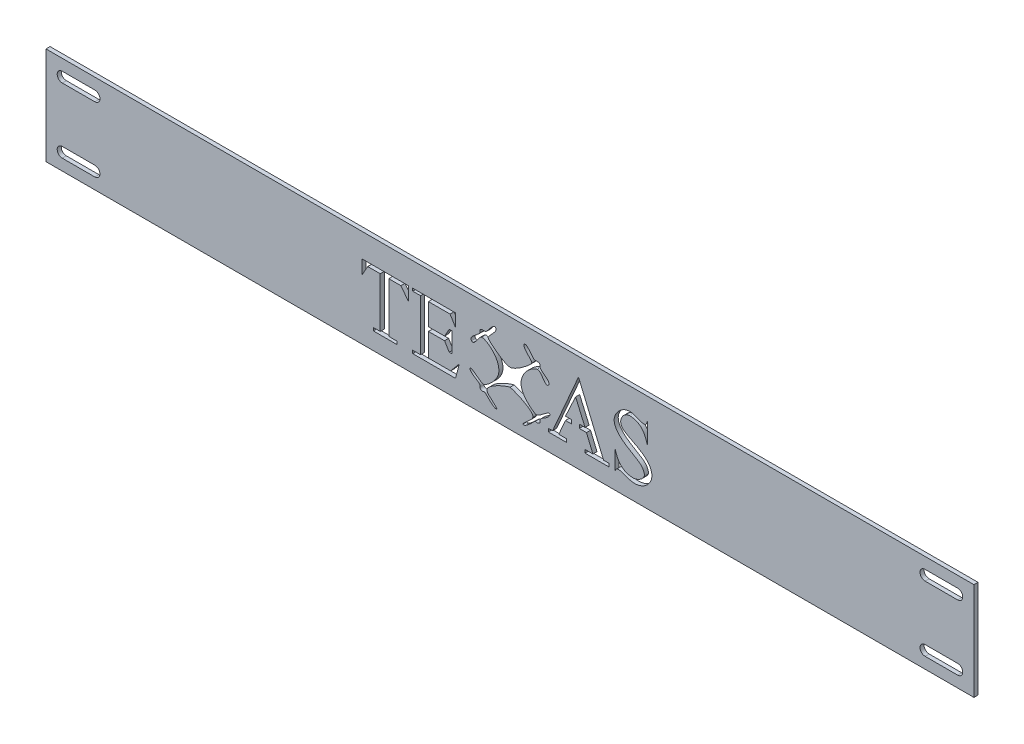
from build123d import *

# Parameters (mm, degrees)
BOSS_EXTRUDE1_DEPTH = 38.1
CUT_EXTRUDE2_DEPTH  = 364.95320119
CUT_EXTRUDE3_START  = -1.5875
CUT_EXTRUDE3_DEPTH  = 1.5875


# Read off the part's stored shape, not the designer's step: Cut-Extrude3
with BuildPart() as part:
    # Sketch1 → Boss-Extrude1 (new body)
    with BuildSketch(Plane(origin=(0, 0, 0), x_dir=(1, 0, 0), z_dir=(0, 1, 0))):
        Polygon((0, 0), (361.95, 0), (361.95, 1.5875), (336.55, 1.5875), (25.4, 1.5875), (0, 1.5875), align=None)
    extrude(amount=BOSS_EXTRUDE1_DEPTH)

    # Sketch3 → Cut-Extrude2 (cut, through all)
    with BuildSketch(Plane.XY):
        with BuildLine():
            Line((6.35, 33.734375), (19.05, 33.734375))
            ThreePointArc((19.05, 33.734375), (21.034375, 31.75), (19.05, 29.765625))
            Line((19.05, 29.765625), (6.35, 29.765625))
            ThreePointArc((6.35, 29.765625), (4.365625, 31.75), (6.35, 33.734375))
        make_face()
        with BuildLine():
            Line((6.35, 4.365625), (19.05, 4.365625))
            ThreePointArc((19.05, 4.365625), (21.034375, 6.35), (19.05, 8.334375))
            Line((19.05, 8.334375), (6.35, 8.334375))
            ThreePointArc((6.35, 8.334375), (4.365625, 6.35), (6.35, 4.365625))
        make_face()
        with BuildLine():
            Line((355.6, 4.365625), (342.9, 4.365625))
            ThreePointArc((342.9, 4.365625), (340.915625, 6.35), (342.9, 8.334375))
            Line((342.9, 8.334375), (355.6, 8.334375))
            ThreePointArc((355.6, 8.334375), (357.584375, 6.35), (355.6, 4.365625))
        make_face()
        with BuildLine():
            Line((355.6, 33.734375), (342.9, 33.734375))
            ThreePointArc((342.9, 33.734375), (340.915625, 31.75), (342.9, 29.765625))
            Line((342.9, 29.765625), (355.6, 29.765625))
            ThreePointArc((355.6, 29.765625), (357.584375, 31.75), (355.6, 33.734375))
        make_face()
    extrude(amount=-CUT_EXTRUDE2_DEPTH, mode=Mode.SUBTRACT)

    # Cut-Extrude3 outline → Cut-Extrude3 (cut)
    with BuildSketch(Plane.XY.offset(CUT_EXTRUDE3_START)):
        with BuildLine():
            add(Edge.make_bspline(
                [(195.982140594, 22.51930704), (194.799865236, 21.213982115), (193.163937726, 26.137072488), (189.808392954, 25.270049762), (185.431809743, 21.906170571), (185.113755929, 14.477855146), (190.414101335, 10.199478727), (192.394392235, 9.974909474), (195.826797456, 13.652267497), (196.575850419, 13.039862322)],
                knots=[0, 0, 0, 0, 0.189051683, 0.236249649, 0.445787434, 0.493959122, 0.669794836, 0.72259687, 1, 1, 1, 1], degree=3))
            add(Edge.make_bspline(
                [(195.982140594, 22.51930704), (197.02384643, 23.690697654), (193.434281531, 25.750289011), (192.471466966, 27.04835261), (192.942024759, 27.620203849), (192.043472718, 28.543432617), (190.501640111, 28.084350881), (189.476887898, 29.418942555), (187.135907428, 32.553032704), (185.644984613, 30.359079477), (189.672624323, 27.572101913), (189.47449607, 26.693468459)],
                knots=[0, 0, 0, 0, 0.213778603, 0.251869609, 0.366572237, 0.395020232, 0.507901568, 0.542963638, 0.710578863, 0.758377689, 1, 1, 1, 1], degree=3))
            add(Edge.make_bspline(
                [(189.47449607, 26.693468459), (189.055350229, 25.68502545), (183.278354398, 21.111711372), (180.975, 21.055893079)],
                knots=[0, 0, 0, 0, 1, 1, 1, 1], degree=3))
            add(Edge.make_bspline(
                [(172.47550393, 26.693468459), (172.894649771, 25.68502545), (178.671645602, 21.111711372), (180.975, 21.055893079)],
                knots=[0, 0, 0, 0, 1, 1, 1, 1], degree=3))
            add(Edge.make_bspline(
                [(165.967859406, 22.51930704), (164.92615357, 23.690697654), (168.515718469, 25.750289011), (169.478533034, 27.04835261), (169.007975241, 27.620203849), (169.906527282, 28.543432617), (171.448359889, 28.084350881), (172.473112102, 29.418942555), (174.814092572, 32.553032704), (176.305015387, 30.359079477), (172.277375677, 27.572101913), (172.47550393, 26.693468459)],
                knots=[0, 0, 0, 0, 0.213778603, 0.251869609, 0.366572237, 0.395020232, 0.507901568, 0.542963638, 0.710578863, 0.758377689, 1, 1, 1, 1], degree=3))
            add(Edge.make_bspline(
                [(165.967859406, 22.51930704), (167.150134764, 21.213982115), (168.786062274, 26.137072488), (172.141607046, 25.270049762), (176.518190257, 21.906170571), (176.836244071, 14.477855146), (171.535898665, 10.199478727), (169.555607765, 9.974909474), (166.123202544, 13.652267497), (165.374149581, 13.039862322)],
                knots=[0, 0, 0, 0, 0.189051683, 0.236249649, 0.445787434, 0.493959122, 0.669794836, 0.72259687, 1, 1, 1, 1], degree=3))
            add(Edge.make_bspline(
                [(165.374149581, 13.039862322), (165.125665487, 12.735624807), (166.110865819, 11.394591), (170.331042773, 9.150480258), (168.679768277, 8.544643648), (170.535734674, 7.173980297), (170.772126154, 8.136761028), (171.983030665, 6.986077763), (174.91960902, 3.896083053), (176.375069108, 4.539812082), (172.62560022, 7.186447587), (171.154498021, 10.491273862), (179.171195487, 14.056091072), (180.975, 14.279388426)],
                knots=[0, 0, 0, 0, 0.064953739, 0.094763719, 0.275506902, 0.324252674, 0.53347567, 0.577930895, 0.724349704, 0.753328343, 0.838738651, 0.864473446, 1, 1, 1, 1], degree=3))
            add(Edge.make_bspline(
                [(196.575850419, 13.039862322), (196.824334513, 12.735624807), (195.839134181, 11.394591), (191.618957227, 9.150480258), (193.270231723, 8.544643648), (191.414265326, 7.173980297), (191.177873846, 8.136761028), (189.966969335, 6.986077763), (187.03039098, 3.896083053), (185.574930892, 4.539812082), (189.32439978, 7.186447587), (190.795501979, 10.491273862), (182.778804513, 14.056091072), (180.975, 14.279388426)],
                knots=[0, 0, 0, 0, 0.064953739, 0.094763719, 0.275506902, 0.324252674, 0.53347567, 0.577930895, 0.724349704, 0.753328343, 0.838738651, 0.864473446, 1, 1, 1, 1], degree=3))
        make_face()
        with BuildLine():
            add(Edge.make_bspline(
                [(234.559937197, 21.645787396), (233.405038462, 25.773760499), (231.363748975, 27.682772658), (225.764180175, 28.326475371), (222.358816397, 22.837585378), (227.899860485, 20.605871866), (239.782021852, 13.818683951), (234.998253663, 6.441976622), (227.668644767, 5.928189123), (224.066232809, 8.264523772), (222.014289381, 7.441374025), (222.007609782, 6.32598658)],
                knots=[0, 0, 0, 0, 0.099418507, 0.119055882, 0.196373746, 0.311779581, 0.364307852, 0.681951059, 0.739922882, 0.886054264, 0.999151476, 0.999151476, 0.999151476, 0.999151476], degree=3))
            Line((234.559937197, 21.645787396), (234.559937197, 29.5793327))
            add(Edge.make_bspline(
                [(222.00760979, 13.905297607), (223.191069921, 9.673284198), (225.738636972, 7.861739614), (230.39632568, 7.547401713), (233.677201092, 9.585984013), (232.924658543, 14.03915234), (226.110704155, 16.617096632), (219.29629893, 23.359750676), (224.592787354, 29.453328502), (229.559834974, 29.570804062), (231.65057135, 28.071440195), (233.870318457, 27.992046353), (234.231970618, 28.386726957), (234.559937197, 29.5793327)],
                knots=[0, 0, 0, 0, 0.172538877, 0.202430715, 0.288197524, 0.317942668, 0.489161301, 0.653503064, 0.806060397, 0.83407712, 0.922604386, 0.940303265, 1, 1, 1, 1], degree=3))
            Line((222.00760979, 13.905297607), (222.007609782, 6.32598658))
        make_face()
        Polygon((123.259334489, 28.808787432), (123.259334489, 23.393470937), (125.502822751, 27.338915812), (130.376607596, 27.338915812), (130.376607596, 7.843776432), (127.668949349, 7.843776432), (127.668949349, 6.683351469), (136.952349054, 6.683351469), (136.952349054, 7.843776432), (133.703159157, 7.843776432), (133.703159157, 27.338915812), (138.422220674, 27.338915812), (141.439325578, 23.393470937), (141.439325578, 28.808787432), align=None)
        Polygon((159.743542233, 28.808787432), (143.047964228, 28.808787432), (143.047964228, 27.784450216), (146.107363339, 27.784450216), (146.107363339, 7.843776432), (143.047964228, 7.843776432), (143.047964228, 6.683351469), (159.743542233, 6.683351469), (161.229536087, 12.312631855), (157.838299976, 8.248001608), (149.16676245, 8.248001608), (149.16676245, 17.255910832), (155.460383478, 17.255910832), (157.287934469, 14.279388426), (158.388665484, 14.279388426), (158.388665484, 22.038750376), (157.287934469, 22.038750376), (155.460383478, 18.824781391), (149.16676245, 18.824781391), (149.16676245, 27.338915812), (157.601962855, 27.338915812), (159.743542233, 23.850937073), align=None)
        Polygon((195.982140594, 7.925010214), (195.982140594, 6.683351469), (202.971167131, 6.683351469), (202.971167131, 7.925010214), (200.020405801, 7.925010214), (202.629948082, 13.905297607), (205.029963996, 13.905297607), (205.029963996, 15.367463245), (202.629948082, 15.367463245), (206.572892797, 23.850937073), (210.264724304, 15.367463245), (208.009608137, 15.367463245), (208.009608137, 13.905297607), (210.819205258, 13.905297607), (213.335695745, 7.925010214), (210.264724304, 7.925010214), (210.264724304, 6.683351469), (219.520291009, 6.683351469), (219.520291009, 7.925010214), (217.472976714, 7.925010214), (207.713917718, 31.116823492), (197.593999839, 7.925010214), align=None)
    extrude(amount=CUT_EXTRUDE3_DEPTH, mode=Mode.SUBTRACT)


solid = part.part
